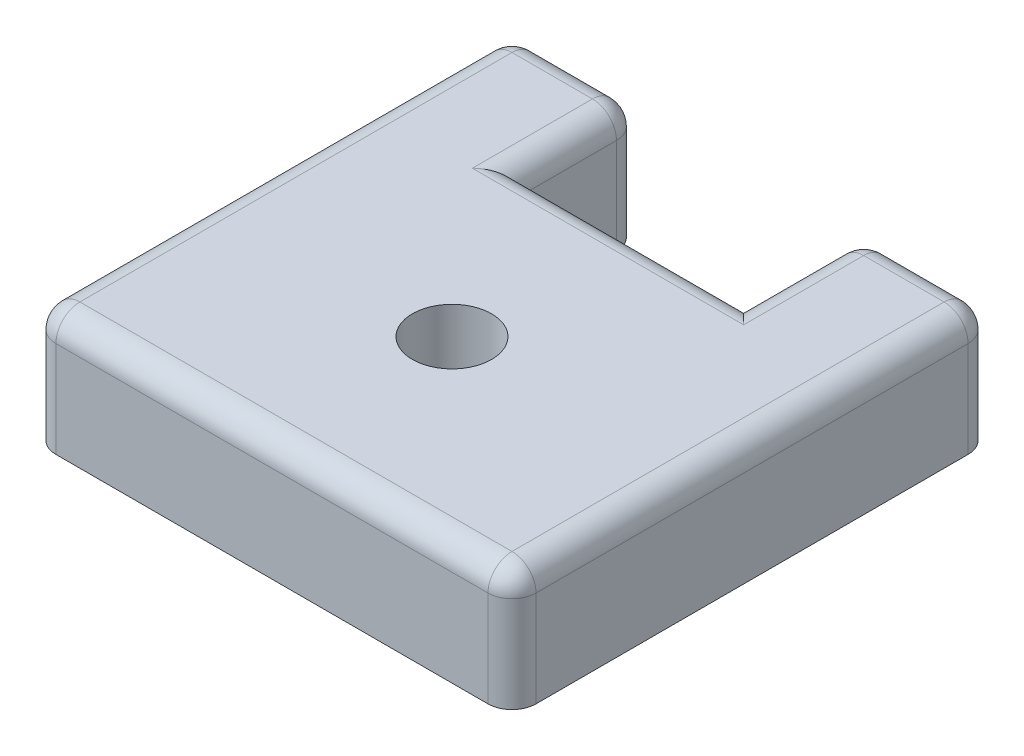
from build123d import *

# Parameters (mm, degrees)
BOSS_EXTRUDE1_DEPTH = 5
FILLET1_R           = 1
SKETCH3_R           = 1.65
CUT_EXTRUDE1_DEPTH  = 29.722813233


with BuildPart() as part:
    # Sketch2 → Boss-Extrude1 (new body)
    with BuildSketch(Plane(origin=(0, 0, 0), x_dir=(1, 0, 0), z_dir=(0, 1, 0))):
        Polygon((14.65, 20), (20, 20), (20, 0), (0, 0), (0, 20), (5.35, 20), (5.35, 15), (14.65, 15), align=None)
    extrude(amount=BOSS_EXTRUDE1_DEPTH)

    # Fillet1
    fillet1_edges = [part.edges().sort_by_distance(p)[0] for p in [
        (0, 5, -10),
        (2.675, 5, -20),
        (5.35, 5, -17.5),
        (10, 5, -15),
        (14.65, 5, -17.5),
        (17.325, 5, -20),
        (20, 5, -10),
        (10, 5, 0),
        (0, 2.5, 0),
        (20, 2.5, 0),
        (20, 2.5, -20),
        (0, 2.5, -20),
        (14.65, 2.5, -20),
        (5.35, 2.5, -20),
    ]]
    fillet(fillet1_edges, radius=FILLET1_R)

    # Sketch3 → Cut-Extrude1 (cut, through all)
    with BuildSketch(Plane(origin=(0, 5, 0), x_dir=(1, 0, 0), z_dir=(0, 1, 0))):
        with Locations((10, 7.5)):
            Circle(SKETCH3_R)
    extrude(amount=-CUT_EXTRUDE1_DEPTH, mode=Mode.SUBTRACT)


solid = part.part
